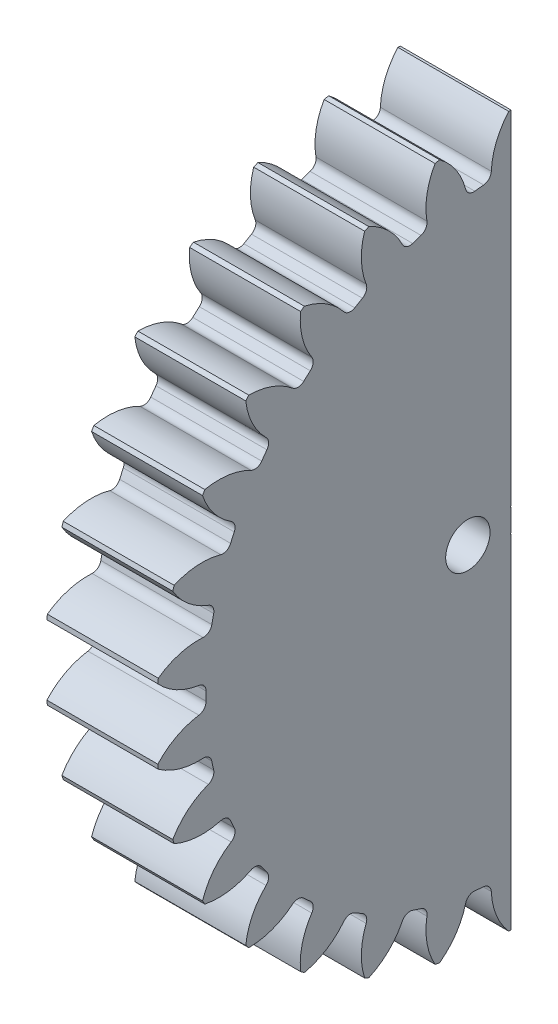
from build123d import *

# Parameters (mm, degrees)
SKETCH1_R                = 32
BOSS_EXTRUDE1_DEPTH      = 10
CUT_EXTRUDE1_DEPTH       = 47.346520905
FILLET1_R                = 0.76
CIRPATTERN1_COUNT        = 30
FILLET1_OF_CIRPATTERN1_R = 0.76
CUT_EXTRUDE3_DEPTH       = 47.240252284
CUT_EXTRUDE10_DEPTH      = 47.240252284
CUT_EXTRUDE10_DEPTH_BACK = 47.240252284
SKETCH32_W               = 0.1
SKETCH32_H               = 0.05
CUT_EXTRUDE12_DEPTH      = 47.240252284
CUT_EXTRUDE12_DEPTH_BACK = 47.240252284
SKETCH34_R               = 2


with BuildPart() as part:
    # Sketch1 → Boss-Extrude1 (new body)
    with BuildSketch(Plane.YZ):
        Circle(SKETCH1_R)
    extrude(amount=BOSS_EXTRUDE1_DEPTH)

    # Sketch2 → Cut-Extrude1 (cut, through all)
    with BuildSketch(Plane.YZ.offset(10)):
        with BuildLine():
            ThreePointArc((1.099946167, 27.477993348), (0, 27.5), (-1.099946167, 27.477993348))
            ThreePointArc((-1.099946167, 27.477993348), (-1.679808131, 29.866433483), (-3.136731338, 31.845893244))
            ThreePointArc((-3.136731338, 31.845893244), (0, 32), (3.136731338, 31.845893244))
            ThreePointArc((3.136731338, 31.845893244), (1.679808131, 29.866433483), (1.099946167, 27.477993348))
        make_face()
    cut_extrude1 = extrude(amount=-CUT_EXTRUDE1_DEPTH, mode=Mode.SUBTRACT)

    # Fillet1
    fillet1_edges = [part.edges().sort_by_distance(p)[0] for p in [
        (5, 1.099946167, 27.477993348),
        (5, -1.099946167, 27.477993348),
    ]]
    fillet(fillet1_edges, radius=FILLET1_R)

    # CirPattern1: Cut-Extrude1 ×30 about axis
    cirpattern1_axis = Axis((10, 0, 0), (1, 0, 0))
    for i in range(1, CIRPATTERN1_COUNT):
        add(cut_extrude1.rotate(cirpattern1_axis, i * 360 / CIRPATTERN1_COUNT), mode=Mode.SUBTRACT)

    # Fillet1 of CirPattern1
    fillet1_of_cirpattern1_edges = [part.edges().sort_by_distance(p)[0] for p in [
        (5, -4.637086353, 27.106224934),
        (5, -6.788905761, 26.648841599),
        (5, -10.171455948, 25.54978442),
        (5, -12.181157597, 24.655007597),
        (5, -15.261284111, 22.876695725),
        (5, -17.041034394, 21.583631455),
        (5, -19.684120925, 19.203785653),
        (5, -21.156136217, 17.568947048),
        (5, -23.246667201, 14.691577997),
        (5, -24.346613368, 12.786415351),
        (5, -25.79322257, 9.537277885),
        (5, -26.473026687, 7.445055946),
        (5, -27.212490343, 3.966152965),
        (5, -27.442441708, 1.778311872),
        (5, -27.442441708, -1.778311872),
        (5, -27.212490343, -3.966152965),
        (5, -26.473026687, -7.445055946),
        (5, -25.79322257, -9.537277885),
        (5, -24.346613368, -12.786415351),
        (5, -23.246667201, -14.691577997),
        (5, -21.156136217, -17.568947048),
        (5, -19.684120925, -19.203785653),
        (5, -17.041034394, -21.583631455),
        (5, -15.261284111, -22.876695725),
        (5, -12.181157597, -24.655007597),
        (5, -10.171455948, -25.54978442),
        (5, -6.788905761, -26.648841599),
        (5, -4.637086353, -27.106224934),
        (5, -1.099946167, -27.477993348),
        (5, 1.099946167, -27.477993348),
        (5, 4.637086353, -27.106224934),
        (5, 6.788905761, -26.648841599),
        (5, 10.171455948, -25.54978442),
        (5, 12.181157597, -24.655007597),
        (5, 15.261284111, -22.876695725),
        (5, 17.041034394, -21.583631455),
        (5, 19.684120925, -19.203785653),
        (5, 21.156136217, -17.568947048),
        (5, 23.246667201, -14.691577997),
        (5, 24.346613368, -12.786415351),
        (5, 25.79322257, -9.537277885),
        (5, 26.473026687, -7.445055946),
        (5, 27.212490343, -3.966152965),
        (5, 27.442441708, -1.778311872),
        (5, 27.442441708, 1.778311872),
        (5, 27.212490343, 3.966152965),
        (5, 26.473026687, 7.445055946),
        (5, 25.79322257, 9.537277885),
        (5, 24.346613368, 12.786415351),
        (5, 23.246667201, 14.691577997),
        (5, 21.156136217, 17.568947048),
        (5, 19.684120925, 19.203785653),
        (5, 17.041034394, 21.583631455),
        (5, 15.261284111, 22.876695725),
        (5, 12.181157597, 24.655007597),
        (5, 10.171455948, 25.54978442),
        (5, 6.788905761, 26.648841599),
        (5, 4.637086353, 27.106224934),
    ]]
    fillet(fillet1_of_cirpattern1_edges, radius=FILLET1_OF_CIRPATTERN1_R)

    # Sketch4 → Cut-Extrude3 (cut, through all)
    with BuildSketch(Plane.YZ.offset(10)):
        with BuildLine():
            Line((-32, 0), (32, 0))
            ThreePointArc((32, 0), (0, -32), (-32, 0))
        make_face()
    extrude(amount=-CUT_EXTRUDE3_DEPTH, mode=Mode.SUBTRACT)

    # Sketch32 → Cut-Extrude10 (cut, two sides: drawn at the far end of the back side and taken through both)
    with BuildSketch(Plane.YZ.offset(10).offset(-CUT_EXTRUDE10_DEPTH_BACK)):
        with Locations((1.05, 0.025)):
            Rectangle(SKETCH32_W, SKETCH32_H)
        with Locations((-1.05, 0.025)):
            Rectangle(SKETCH32_W, SKETCH32_H)
    extrude(amount=CUT_EXTRUDE10_DEPTH + CUT_EXTRUDE10_DEPTH_BACK, mode=Mode.SUBTRACT)

    # Sketch34 → Cut-Extrude12 (cut, two sides: drawn at the far end of the back side and taken through both)
    with BuildSketch(Plane(origin=(10, 0, 0), x_dir=(0, 0, -1), z_dir=(1, 0, 0)).offset(-CUT_EXTRUDE12_DEPTH_BACK)):
        with Locations((-3.9, 0)):
            Circle(SKETCH34_R)
    extrude(amount=CUT_EXTRUDE12_DEPTH + CUT_EXTRUDE12_DEPTH_BACK, mode=Mode.SUBTRACT)


solid = part.part
